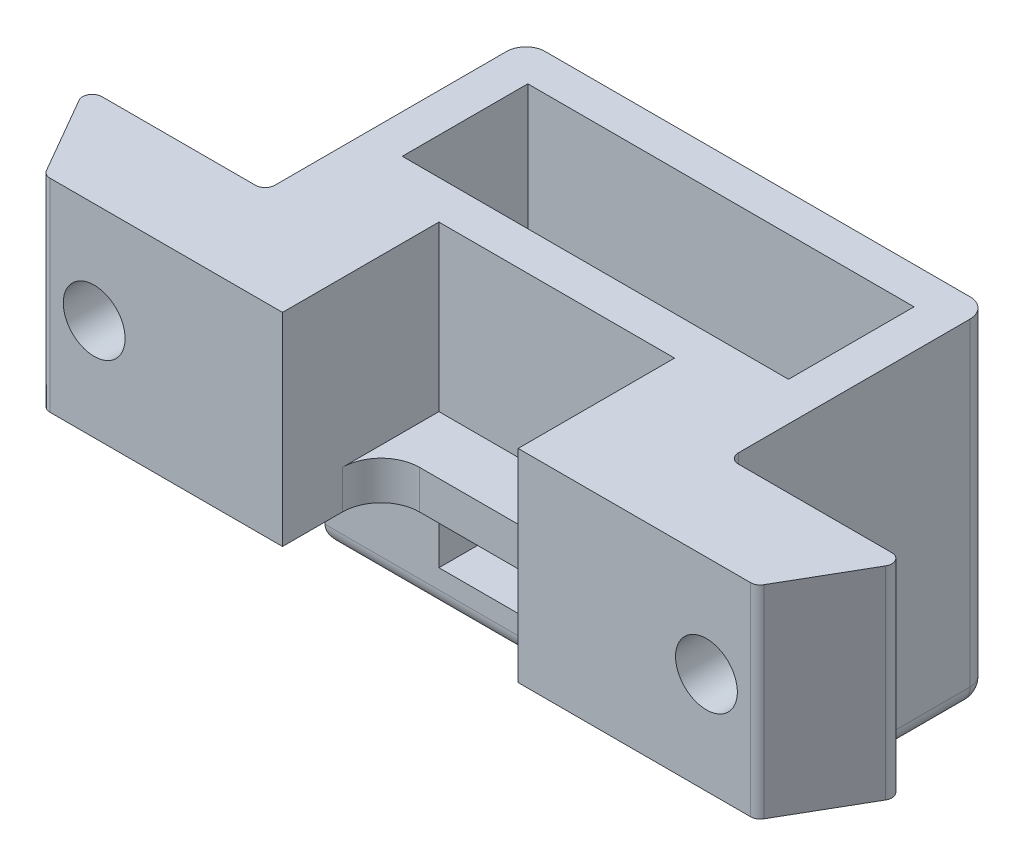
from build123d import *

# Parameters (mm, degrees)
SKETCH1_W           = 20
SKETCH1_H           = 6.5
BOSS_EXTRUDE1_DEPTH = 10.5
BOSS_EXTRUDE2_START = 5
BOSS_EXTRUDE2_DEPTH = 5
BOSS_EXTRUDE3_START = 2
BOSS_EXTRUDE3_DEPTH = 2
SKETCH7_W           = 12.2
SKETCH7_H           = 2
BOSS_EXTRUDE5_DEPTH = 3
FILLET2_R           = 2
CUT_EXTRUDE2_REACH  = 34.554
SKETCH8_R           = 1.6
CUT_EXTRUDE3_REACH  = 36.925
FILLET8_R           = 0.5
FILLET9_R           = 1
CUT_EXTRUDE4_REACH  = 36.411
SKETCH10_R          = 1.25


with BuildPart() as part:
    # Sketch1 → Boss-Extrude1 (new body)
    with BuildSketch(Plane(origin=(0, 0, 0), x_dir=(1, 0, 0), z_dir=(0, 1, 0))):
        with BuildLine():
            Line((0, 0), (0, 8.1))
            Line((0, 8.1), (12.2, 8.1))
            Line((12.2, 8.1), (12.2, 0))
            Line((12.2, 0), (27.7, 0))
            Line((27.7, 0), (27.7, 4.5))
            ThreePointArc((27.7, 4.5), (27.553553391, 4.853553391), (27.2, 5))
            Line((27.2, 5), (18.6, 5))
            ThreePointArc((18.6, 5), (18.246446609, 5.146446609), (18.1, 5.5))
            Line((18.1, 5.5), (18.1, 17.5))
            ThreePointArc((18.1, 17.5), (17.807106781, 18.207106781), (17.1, 18.5))
            Line((17.1, 18.5), (-4.9, 18.5))
            ThreePointArc((-4.9, 18.5), (-5.607106781, 18.207106781), (-5.9, 17.5))
            Line((-5.9, 17.5), (-5.9, 5.5))
            ThreePointArc((-5.9, 5.5), (-6.046446609, 5.146446609), (-6.4, 5))
            Line((-6.4, 5), (-15, 5))
            ThreePointArc((-15, 5), (-15.353553391, 4.853553391), (-15.5, 4.5))
            Line((-15.5, 4.5), (-15.5, 0))
            Line((-15.5, 0), (0, 0))
        make_face()
        with Locations((6.1, 13.35)):
            Rectangle(SKETCH1_W, SKETCH1_H, mode=Mode.SUBTRACT)
    extrude(amount=BOSS_EXTRUDE1_DEPTH)

    # Sketch5 → Boss-Extrude2 (add)
    with BuildSketch(Plane.XZ.offset(BOSS_EXTRUDE2_START)):
        with BuildLine():
            Line((0, -8.1), (-5.9, -8.1))
            Line((-5.9, -8.1), (-5.9, -17.5))
            ThreePointArc((-5.9, -17.5), (-5.607106781, -18.207106781), (-4.9, -18.5))
            Line((-4.9, -18.5), (17.1, -18.5))
            ThreePointArc((17.1, -18.5), (17.807106781, -18.207106781), (18.1, -17.5))
            Line((18.1, -17.5), (18.1, -8.1))
            Line((18.1, -8.1), (12.2, -8.1))
            Line((12.2, -8.1), (12.2, -10.1))
            Line((12.2, -10.1), (16.1, -10.1))
            Line((16.1, -10.1), (16.1, -16.6))
            Line((16.1, -16.6), (-3.9, -16.6))
            Line((-3.9, -16.6), (-3.9, -10.1))
            Line((-3.9, -10.1), (0, -10.1))
            Line((0, -10.1), (0, -8.1))
        make_face()
    extrude(amount=-BOSS_EXTRUDE2_DEPTH)

    # Sketch6 → Boss-Extrude3 (add)
    with BuildSketch(Plane.XZ.offset(5).offset(BOSS_EXTRUDE3_START)):
        with BuildLine():
            Line((-5.9, -8.1), (18.1, -8.1))
            Line((18.1, -8.1), (18.1, -17.5))
            ThreePointArc((18.1, -17.5), (17.807106781, -18.207106781), (17.1, -18.5))
            Line((17.1, -18.5), (-4.9, -18.5))
            ThreePointArc((-4.9, -18.5), (-5.607106781, -18.207106781), (-5.9, -17.5))
            Line((-5.9, -17.5), (-5.9, -8.1))
        make_face()
    extrude(amount=-BOSS_EXTRUDE3_DEPTH)

    # Sketch7 → Boss-Extrude5 (add)
    with BuildSketch(Plane.XY.offset(-8.1)):
        with Locations((6.1, 1)):
            Rectangle(SKETCH7_W, SKETCH7_H)
    extrude(amount=BOSS_EXTRUDE5_DEPTH)

    # Fillet2
    fillet2_edges = [part.edges().sort_by_distance(p)[0] for p in [
        (12.2, 1, -5.1),
        (0, 1, -5.1),
    ]]
    fillet(fillet2_edges, radius=FILLET2_R)

    # Sketch8 → Cut-Extrude2 (cut, up to next)
    with BuildSketch(Plane(origin=(0, 0, -5), x_dir=(-1, 0, 0), z_dir=(0, 0, -1)), mode=Mode.PRIVATE) as cut_extrude2_sk1:
        with Locations((-21.95, 5.25)):
            Circle(SKETCH8_R)
    cut_extrude2_tool1 = extrude(cut_extrude2_sk1.sketch, amount=-CUT_EXTRUDE2_REACH, mode=Mode.PRIVATE) & part.part
    # Sketch8 → Cut-Extrude2 (cut, up to next)
    with BuildSketch(Plane(origin=(0, 0, -5), x_dir=(-1, 0, 0), z_dir=(0, 0, -1)), mode=Mode.PRIVATE) as cut_extrude2_sk2:
        with Locations((9.75, 5.25)):
            Circle(SKETCH8_R)
    cut_extrude2_tool2 = extrude(cut_extrude2_sk2.sketch, amount=-CUT_EXTRUDE2_REACH, mode=Mode.PRIVATE) & part.part
    add(cut_extrude2_tool1.solids().sort_by_distance((21.95, 5.25, -5))[0], mode=Mode.SUBTRACT)
    add(cut_extrude2_tool2.solids().sort_by_distance((-9.75, 5.25, -5))[0], mode=Mode.SUBTRACT)

    # Sketch9 → Cut-Extrude3 (cut, up to next)
    with BuildSketch(Plane.XZ, mode=Mode.PRIVATE) as cut_extrude3_sk1:
        with BuildLine():
            Line((24.52766766, 0), (27.392231541, -4.961570184))
            ThreePointArc((27.392231541, -4.961570184), (27.616002266, -4.777384417), (27.7, -4.5))
            Line((27.7, -4.5), (27.7, 0))
            Line((27.7, 0), (24.52766766, 0))
        make_face()
    cut_extrude3_tool1 = extrude(cut_extrude3_sk1.sketch, amount=-CUT_EXTRUDE3_REACH, mode=Mode.PRIVATE) & part.part
    # Sketch9 → Cut-Extrude3 (cut, up to next)
    with BuildSketch(Plane.XZ, mode=Mode.PRIVATE) as cut_extrude3_sk2:
        with BuildLine():
            Line((-12.327667659, 0), (-15.5, 0))
            Line((-15.5, 0), (-15.5, -4.5))
            ThreePointArc((-15.5, -4.5), (-15.416002266, -4.777384417), (-15.19223154, -4.961570184))
            Line((-15.19223154, -4.961570184), (-12.327667659, 0))
        make_face()
    cut_extrude3_tool2 = extrude(cut_extrude3_sk2.sketch, amount=-CUT_EXTRUDE3_REACH, mode=Mode.PRIVATE) & part.part
    add(cut_extrude3_tool1.solids().sort_by_distance((26.628979, 0, -1.786116))[0], mode=Mode.SUBTRACT)
    add(cut_extrude3_tool2.solids().sort_by_distance((-14.428979, 0, -1.786116))[0], mode=Mode.SUBTRACT)

    # Fillet8
    fillet8_edges = [part.edges().sort_by_distance(p)[0] for p in [
        (-12.327667659, 5.25, 0),
    ]]
    fillet(fillet8_edges, radius=FILLET8_R)
    fillet8_2_edges = [part.edges().sort_by_distance(p)[0] for p in [
        (-15.19223154, 5.25, -4.961570184),
    ]]
    fillet(fillet8_2_edges, radius=FILLET8_R)
    fillet8_3_edges = [part.edges().sort_by_distance(p)[0] for p in [
        (27.392231541, 5.25, -4.961570184),
    ]]
    fillet(fillet8_3_edges, radius=FILLET8_R)
    fillet8_4_edges = [part.edges().sort_by_distance(p)[0] for p in [
        (24.52766766, 5.25, 0),
    ]]
    fillet(fillet8_4_edges, radius=FILLET8_R)

    # Fillet9
    fillet9_edges = [part.edges().sort_by_distance(p)[0] for p in [
        (-5.9, -7, -12.8),
        (18.1, -7, -12.8),
        (6.1, -7, -8.1),
        (-5.607106781, -7, -18.207106781),
        (6.1, -7, -18.5),
        (17.807106781, -7, -18.207106781),
    ]]
    fillet(fillet9_edges, radius=FILLET9_R)

    # Sketch10 → Cut-Extrude4 (cut, up to next)
    with BuildSketch(Plane(origin=(0, 0, -18.5), x_dir=(-1, 0, 0), z_dir=(0, 0, -1)), mode=Mode.PRIVATE) as cut_extrude4_sk1:
        with Locations((-11.25, 2.75)):
            Circle(SKETCH10_R)
    cut_extrude4_tool1 = extrude(cut_extrude4_sk1.sketch, amount=-CUT_EXTRUDE4_REACH, mode=Mode.PRIVATE) & part.part
    # Sketch10 → Cut-Extrude4 (cut, up to next)
    with BuildSketch(Plane(origin=(0, 0, -18.5), x_dir=(-1, 0, 0), z_dir=(0, 0, -1)), mode=Mode.PRIVATE) as cut_extrude4_sk2:
        with Locations((-1.9, 2.75)):
            Circle(SKETCH10_R)
    cut_extrude4_tool2 = extrude(cut_extrude4_sk2.sketch, amount=-CUT_EXTRUDE4_REACH, mode=Mode.PRIVATE) & part.part
    add(cut_extrude4_tool1.solids().sort_by_distance((11.25, 2.75, -18.5))[0], mode=Mode.SUBTRACT)
    add(cut_extrude4_tool2.solids().sort_by_distance((1.9, 2.75, -18.5))[0], mode=Mode.SUBTRACT)


solid = part.part
